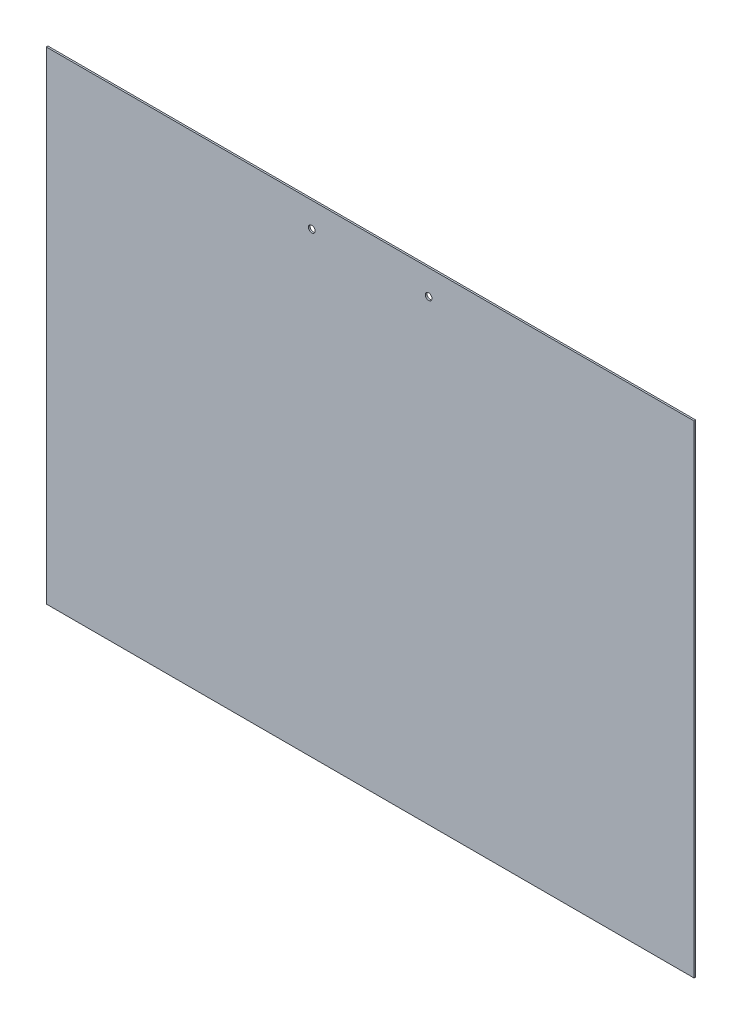
from build123d import *

# Parameters (mm, degrees)
SKETCH1_W           = 388
SKETCH1_H           = 289
SKETCH1_R           = 2
BOSS_EXTRUDE1_DEPTH = 1


with BuildPart() as part:
    # Sketch1 → Boss-Extrude1 (new body)
    with BuildSketch(Plane.XY):
        Rectangle(SKETCH1_W, SKETCH1_H)
        with Locations((-35, 129.5)):
            Circle(SKETCH1_R, mode=Mode.SUBTRACT)
        with Locations((35, 129.5)):
            Circle(SKETCH1_R, mode=Mode.SUBTRACT)
    extrude(amount=BOSS_EXTRUDE1_DEPTH)


solid = part.part
